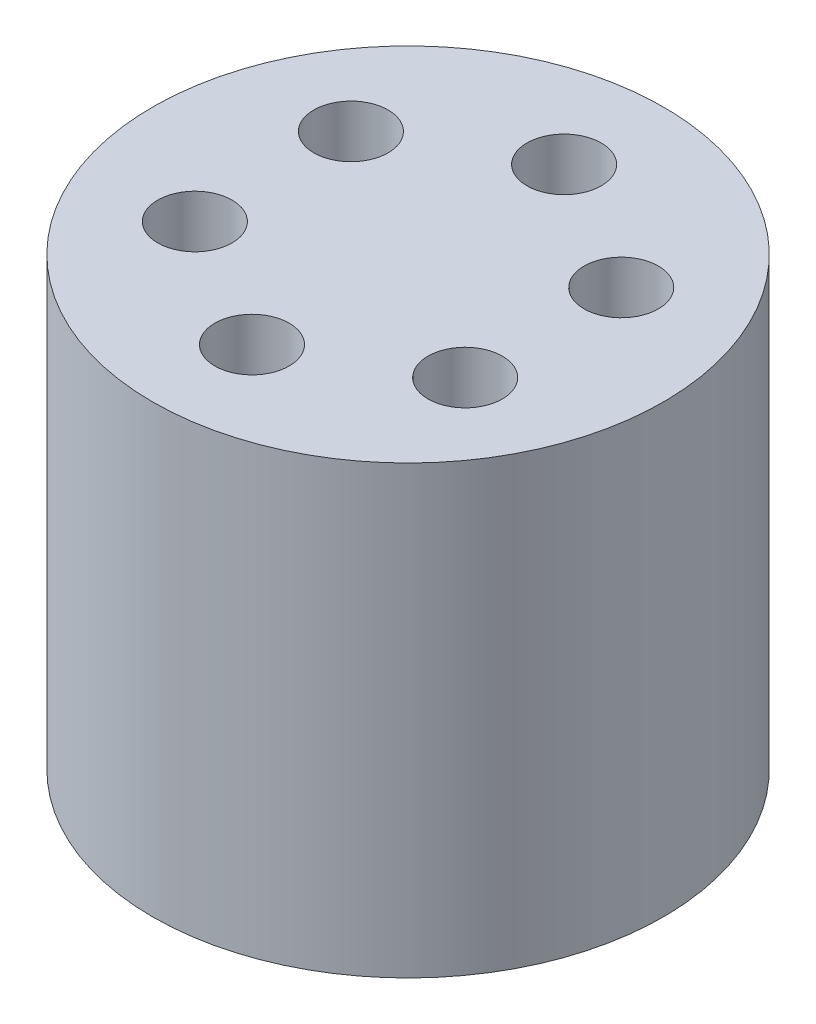
from build123d import *

# Parameters (mm, degrees)
SKETCH1_R           = 18.9
BOSS_EXTRUDE1_DEPTH = 33
SKETCH2_R           = 2.75
CUT_EXTRUDE1_DEPTH  = 25.4


with BuildPart() as part:
    # Sketch1 → Boss-Extrude1 (new body)
    with BuildSketch(Plane(origin=(0, 0, 0), x_dir=(1, 0, 0), z_dir=(0, 1, 0))):
        Circle(SKETCH1_R)
    extrude(amount=BOSS_EXTRUDE1_DEPTH)

    # Sketch2 → Cut-Extrude1 (cut)
    with BuildSketch(Plane(origin=(0, 33, 0), x_dir=(1, 0, 0), z_dir=(0, 1, 0))):
        with Locations((0, 11.547005384)):
            Circle(SKETCH2_R)
        with Locations((-10, 5.773502692)):
            Circle(SKETCH2_R)
        with Locations((10, 5.773502692)):
            Circle(SKETCH2_R)
        with Locations((-10, -5.773502692)):
            Circle(SKETCH2_R)
        with Locations((10, -5.773502692)):
            Circle(SKETCH2_R)
        with Locations((0, -11.547005384)):
            Circle(SKETCH2_R)
    extrude(amount=-CUT_EXTRUDE1_DEPTH, mode=Mode.SUBTRACT)


solid = part.part
